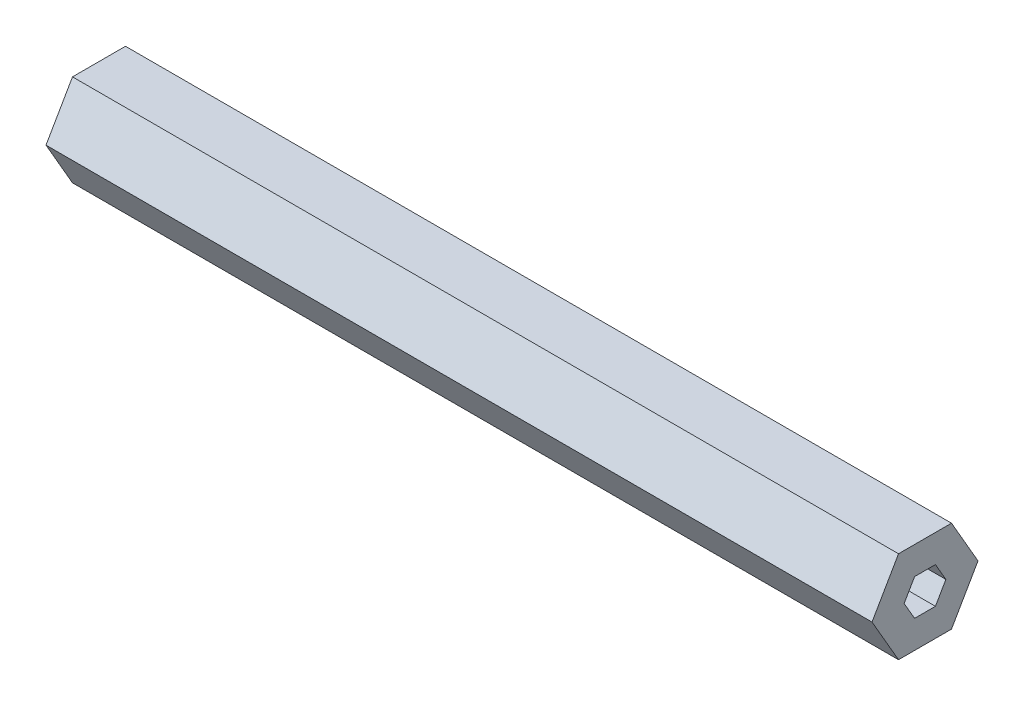
from build123d import *

# Parameters (mm, degrees)
BOSS_EXTRUDE1_DEPTH = 57.15


with BuildPart() as part:
    # Sketch1 → Boss-Extrude1 (new, symmetric)
    with BuildSketch(Plane(origin=(0, 0, 0), x_dir=(0, 0, -1), z_dir=(1, 0, 0))):
        Polygon((7.332348419, 0), (3.666174209, 6.35), (-3.666174209, 6.35), (-7.332348419, 0), (-3.666174209, -6.35), (3.666174209, -6.35), align=None)
        Polygon((2.886751346, 0), (1.443375673, 2.5), (-1.443375673, 2.5), (-2.886751346, 0), (-1.443375673, -2.5), (1.443375673, -2.5), align=None, mode=Mode.SUBTRACT)
    extrude(amount=BOSS_EXTRUDE1_DEPTH, both=True)


solid = part.part
